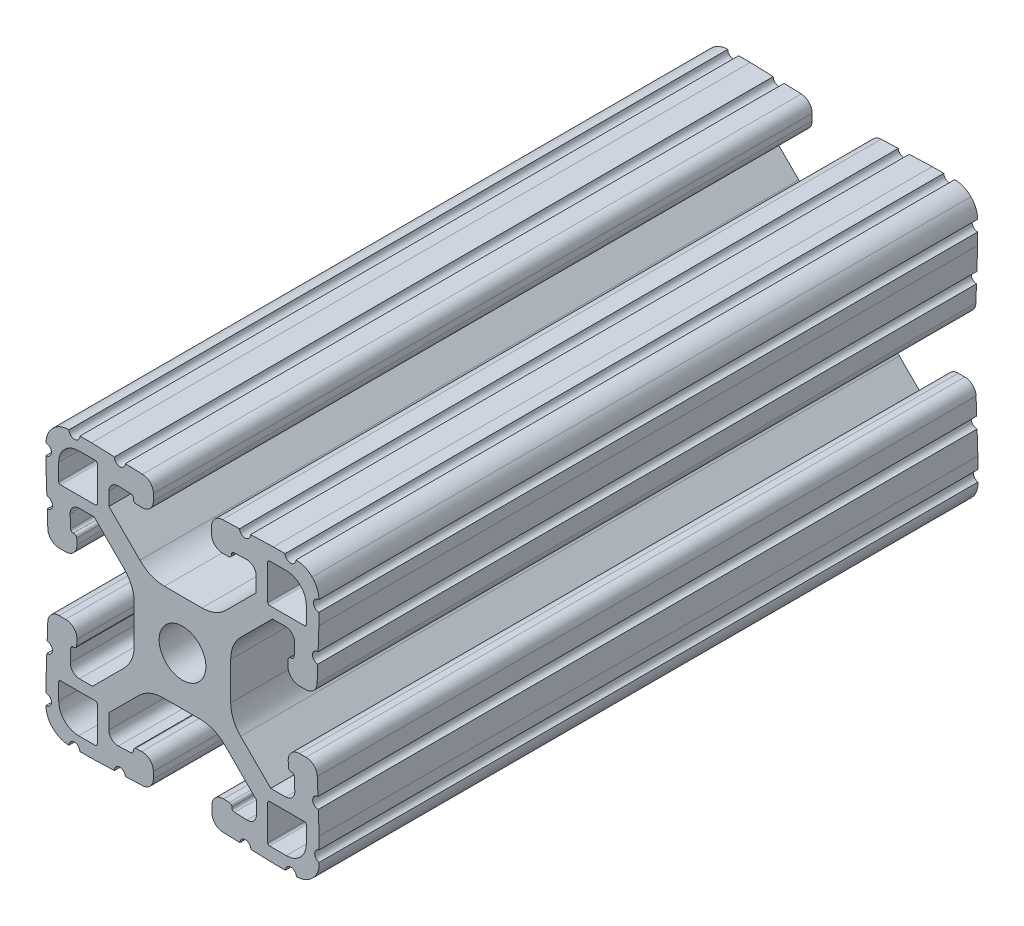
from build123d import *

# Parameters (mm, degrees)
SKETCH1_R           = 3.2639
BOSS_EXTRUDE1_DEPTH = 91.9353


with BuildPart() as part:
    # Sketch1 → Boss-Extrude1 (new body)
    with BuildSketch(Plane(origin=(0, 0, -25.4), x_dir=(-1, 0, 0), z_dir=(0, 0, -1))):
        with BuildLine():
            Line((-88.043721549, 91.862643967), (-86.29674679, 91.923648859))
            ThreePointArc((-86.29674679, 91.923648859), (-85.370208675, 91.567983831), (-84.982425017, 90.654422489))
            Line((-84.982425017, 90.654422489), (-84.982425017, 88.800173916))
            Line((-84.982425017, 88.800173916), (-89.306565884, 84.476033049))
            ThreePointArc((-89.306565884, 84.476033049), (-90.866149908, 83.406077005), (-92.719610366, 83.029523439))
            Line((-92.719610366, 83.029523439), (-97.961628589, 83.029523439))
            ThreePointArc((-97.961628589, 83.029523439), (-99.779298356, 83.391080435), (-101.320244378, 84.42070765))
            Line((-101.320244378, 84.42070765), (-105.516001761, 88.616465033))
            Line((-105.516001761, 88.616465033), (-105.516001761, 90.731330035))
            ThreePointArc((-105.516001761, 90.731330035), (-105.128218103, 91.644891377), (-104.201679988, 92.000556406))
            Line((-104.201679988, 92.000556406), (-102.454705229, 91.939551513))
            ThreePointArc((-102.454705229, 91.939551513), (-102.193933359, 91.823448504), (-102.087001761, 91.558783602))
            ThreePointArc((-102.087001761, 91.558783602), (-102.010859042, 91.249291513), (-101.726191901, 91.105946874))
            Line((-101.726191901, 91.105946874), (-100.929727576, 91.078102142))
            ThreePointArc((-100.929727576, 91.078102142), (-99.780779944, 91.519102656), (-99.299905511, 92.651940638))
            Line((-99.299905511, 92.651940638), (-99.299905511, 93.566848638))
            ThreePointArc((-99.299905511, 93.566848638), (-99.741889517, 94.660796975), (-100.819746715, 95.140689345))
            Line((-100.819746715, 95.140689345), (-103.211918901, 95.224224422))
            ThreePointArc((-103.211918901, 95.224224422), (-104.000045777, 94.489281495), (-104.734990687, 95.277406522))
            Line((-104.734990687, 95.277406522), (-107.935905676, 95.389166912))
            Line((-107.935905676, 95.389166912), (-109.561454876, 95.389166912))
            ThreePointArc((-109.561454876, 95.389166912), (-110.323454876, 94.627166912), (-111.085454876, 95.389166912))
            ThreePointArc((-111.085454876, 95.389166912), (-112.308767787, 95.144035599), (-113.343184761, 94.446493225))
            ThreePointArc((-113.343184761, 94.446493225), (-114.04072548, 93.412075135), (-114.285854836, 92.188761832))
            ThreePointArc((-114.285854836, 92.188761832), (-113.523853616, 91.426762441), (-114.285853616, 90.664761832))
            Line((-114.285853616, 90.664761832), (-114.285853616, 89.039212632))
            Line((-114.285853616, 89.039212632), (-114.174093219, 85.838297643))
            ThreePointArc((-114.174093219, 85.838297643), (-113.385968191, 85.103352735), (-114.120911115, 84.315225857))
            Line((-114.120911115, 84.315225857), (-114.037376031, 81.923053667))
            ThreePointArc((-114.037376031, 81.923053667), (-113.55748366, 80.845196472), (-112.463535325, 80.403212468))
            Line((-112.463535325, 80.403212468), (-111.548627325, 80.403212468))
            ThreePointArc((-111.548627325, 80.403212468), (-110.415788905, 80.884087354), (-109.974788872, 82.033035791))
            Line((-109.974788872, 82.033035791), (-110.002634241, 82.829500094))
            ThreePointArc((-110.002634241, 82.829500094), (-110.118742417, 83.090261917), (-110.383401914, 83.197188))
            ThreePointArc((-110.383401914, 83.197188), (-110.693757401, 83.272605688), (-110.837665276, 83.557735272))
            Line((-110.837665276, 83.557735272), (-110.898671566, 85.304709982))
            ThreePointArc((-110.898671566, 85.304709982), (-110.543006925, 86.231248747), (-109.62944523, 86.61903277))
            Line((-109.62944523, 86.61903277), (-107.807161806, 86.61903277))
            Line((-107.807161806, 86.61903277), (-103.364925613, 82.176810793))
            ThreePointArc((-103.364925613, 82.176810793), (-102.335294479, 80.635862907), (-101.973736029, 78.81818963))
            Line((-101.973736029, 78.81818963), (-101.973736029, 73.576034207))
            ThreePointArc((-101.973736029, 73.576034207), (-102.335293752, 71.758362684), (-103.364922926, 70.21741573))
            Line((-103.364922926, 70.21741573), (-107.560683666, 66.021661704))
            Line((-107.560683666, 66.021661704), (-109.652436558, 66.021661704))
            ThreePointArc((-109.652436558, 66.021661704), (-110.565998503, 66.409445617), (-110.921663765, 67.335984343))
            Line((-110.921663765, 67.335984343), (-110.860658873, 69.082959102))
            ThreePointArc((-110.860658873, 69.082959102), (-110.744555864, 69.343730973), (-110.479890961, 69.45066257))
            ThreePointArc((-110.479890961, 69.45066257), (-110.173494703, 69.529390272), (-110.032185196, 69.812424443))
            Line((-110.032185196, 69.812424443), (-110.004340464, 70.608888768))
            ThreePointArc((-110.004340464, 70.608888768), (-110.445340978, 71.7578364), (-111.57817896, 72.238710833))
            Line((-111.57817896, 72.238710833), (-112.49308696, 72.238710833))
            ThreePointArc((-112.49308696, 72.238710833), (-113.587035297, 71.796726827), (-114.066927667, 70.718869629))
            Line((-114.066927667, 70.718869629), (-114.150462744, 68.326697443))
            ThreePointArc((-114.150462744, 68.326697443), (-113.415519817, 67.538570567), (-114.203644843, 66.803625657))
            Line((-114.203644843, 66.803625657), (-114.315405233, 63.602710668))
            Line((-114.315405233, 63.602710668), (-114.315405233, 61.962557497))
            ThreePointArc((-114.315405233, 61.962557497), (-113.701927281, 61.206106537), (-114.333208228, 60.464447842))
            ThreePointArc((-114.333208228, 60.464447842), (-114.113020459, 59.176546471), (-113.392816136, 58.086372941))
            ThreePointArc((-113.392816136, 58.086372941), (-112.358398046, 57.388832223), (-111.135084743, 57.143702867))
            ThreePointArc((-111.135084743, 57.143702867), (-110.373085352, 57.905704086), (-109.611084743, 57.143704086))
            Line((-109.611084743, 57.143704086), (-107.985535543, 57.143704086))
            Line((-107.985535543, 57.143704086), (-104.784620554, 57.255464483))
            ThreePointArc((-104.784620554, 57.255464483), (-104.049675645, 58.04358951), (-103.261548768, 57.308646586))
            Line((-103.261548768, 57.308646586), (-100.869376578, 57.39218167))
            ThreePointArc((-100.869376578, 57.39218167), (-99.791519383, 57.872074041), (-99.349535378, 58.966022376))
            Line((-99.349535378, 58.966022376), (-99.349535378, 59.880930376))
            ThreePointArc((-99.349535378, 59.880930376), (-99.830409811, 61.013768358), (-100.979357443, 61.454768873))
            Line((-100.979357443, 61.454768873), (-101.775821768, 61.42692414))
            ThreePointArc((-101.775821768, 61.42692414), (-102.036583684, 61.310816174), (-102.143509978, 61.046156762))
            ThreePointArc((-102.143509978, 61.046156762), (-102.222494916, 60.740061862), (-102.505377386, 60.598958297))
            Line((-102.505377386, 60.598958297), (-104.252352145, 60.537953405))
            ThreePointArc((-104.252352145, 60.537953405), (-105.17889026, 60.893618433), (-105.566673918, 61.807179775))
            Line((-105.566673918, 61.807179775), (-105.566673918, 63.629462758))
            Line((-105.566673918, 63.629462758), (-101.131142468, 68.064994208))
            ThreePointArc((-101.131142468, 68.064994208), (-99.590196446, 69.094621422), (-97.772526678, 69.456178419))
            Line((-97.772526678, 69.456178419), (-92.530356056, 69.456178419))
            ThreePointArc((-92.530356056, 69.456178419), (-90.712686289, 69.094621422), (-89.171740267, 68.064994208))
            Line((-89.171740267, 68.064994208), (-84.975982884, 63.869236825))
            Line((-84.975982884, 63.869236825), (-84.975982884, 61.781050107))
            ThreePointArc((-84.975982884, 61.781050107), (-85.363766542, 60.867488765), (-86.290304657, 60.511823736))
            Line((-86.290304657, 60.511823736), (-88.037279416, 60.572828629))
            ThreePointArc((-88.037279416, 60.572828629), (-88.298051286, 60.688931638), (-88.404982884, 60.95359654))
            ThreePointArc((-88.404982884, 60.95359654), (-88.466593694, 61.278962759), (-88.759626911, 61.433204782))
            Line((-88.759626911, 61.433204782), (-89.556091237, 61.461049514))
            ThreePointArc((-89.556091237, 61.461049514), (-90.705038868, 61.020049), (-91.185913301, 59.887211018))
            Line((-91.185913301, 59.887211018), (-91.185913301, 58.972303018))
            ThreePointArc((-91.185913301, 58.972303018), (-90.743929295, 57.878354681), (-89.666072098, 57.398462311))
            Line((-89.666072098, 57.398462311), (-87.273899911, 57.314927234))
            ThreePointArc((-87.273899911, 57.314927234), (-86.485773036, 58.049870161), (-85.750828126, 57.261745135))
            Line((-85.750828126, 57.261745135), (-82.549913136, 57.149984745))
            Line((-82.549913136, 57.149984745), (-80.924363936, 57.149984745))
            ThreePointArc((-80.924363936, 57.149984745), (-80.162363936, 57.911984745), (-79.400363936, 57.149984745))
            ThreePointArc((-79.400363936, 57.149984745), (-78.177051025, 57.395116058), (-77.142634052, 58.092658432))
            ThreePointArc((-77.142634052, 58.092658432), (-76.445094372, 59.127074031), (-76.199963977, 60.350384428))
            ThreePointArc((-76.199963977, 60.350384428), (-76.961961268, 61.112385783), (-76.199961268, 61.874384428))
            Line((-76.199961268, 61.874384428), (-76.199961268, 63.499933628))
            Line((-76.199961268, 63.499933628), (-76.311721666, 66.700848617))
            ThreePointArc((-76.311721666, 66.700848617), (-77.099846694, 67.435793525), (-76.364903769, 68.223920403))
            Line((-76.364903769, 68.223920403), (-76.448438853, 70.616092593))
            ThreePointArc((-76.448438853, 70.616092593), (-76.928331225, 71.693949788), (-78.02227956, 72.135933792))
            Line((-78.02227956, 72.135933792), (-78.93718756, 72.135933792))
            ThreePointArc((-78.93718756, 72.135933792), (-80.07002598, 71.655058906), (-80.511026012, 70.506110469))
            Line((-80.511026012, 70.506110469), (-80.483180643, 69.709646166))
            ThreePointArc((-80.483180643, 69.709646166), (-80.367072468, 69.448884343), (-80.102412971, 69.34195826))
            ThreePointArc((-80.102412971, 69.34195826), (-79.796317908, 69.262973649), (-79.655214052, 68.980091239))
            Line((-79.655214052, 68.980091239), (-79.594207761, 67.233116529))
            ThreePointArc((-79.594207761, 67.233116529), (-79.949872402, 66.306577764), (-80.863434097, 65.918793741))
            Line((-80.863434097, 65.918793741), (-82.685717521, 65.918793741))
            Line((-82.685717521, 65.918793741), (-87.121258001, 70.35431293))
            ThreePointArc((-87.121258001, 70.35431293), (-88.150863946, 71.895196205), (-88.512450271, 73.712794894))
            Line((-88.512450271, 73.712794894), (-88.512606864, 78.954950317))
            ThreePointArc((-88.512606864, 78.954950317), (-88.151076291, 80.772698182), (-87.121419968, 82.313710679))
            Line((-87.121419968, 82.313710679), (-82.925659228, 86.509464706))
            Line((-82.925659228, 86.509464706), (-80.837473527, 86.509464706))
            ThreePointArc((-80.837473527, 86.509464706), (-79.923911584, 86.121680793), (-79.568246321, 85.195142068))
            Line((-79.568246321, 85.195142068), (-79.629251214, 83.448167309))
            ThreePointArc((-79.629251214, 83.448167309), (-79.745354223, 83.187395438), (-80.010019125, 83.080463841))
            ThreePointArc((-80.010019125, 83.080463841), (-80.335385344, 83.018853031), (-80.489627367, 82.725819813))
            Line((-80.489627367, 82.725819813), (-80.5174721, 81.929355488))
            ThreePointArc((-80.5174721, 81.929355488), (-80.076471586, 80.780407856), (-78.943633603, 80.299533423))
            Line((-78.943633603, 80.299533423), (-78.028725603, 80.299533423))
            ThreePointArc((-78.028725603, 80.299533423), (-76.934777267, 80.741517429), (-76.454884897, 81.819374627))
            Line((-76.454884897, 81.819374627), (-76.37134982, 84.211546813))
            ThreePointArc((-76.37134982, 84.211546813), (-77.106292747, 84.999673689), (-76.31816772, 85.734618599))
            Line((-76.31816772, 85.734618599), (-76.20640733, 88.935533588))
            Line((-76.20640733, 88.935533588), (-76.20640733, 90.561082788))
            ThreePointArc((-76.20640733, 90.561082788), (-76.96840733, 91.323083398), (-76.206406111, 92.085082788))
            ThreePointArc((-76.206406111, 92.085082788), (-76.451535467, 93.308396091), (-77.149076185, 94.342814181))
            ThreePointArc((-77.149076185, 94.342814181), (-78.183493159, 95.040356555), (-79.40680607, 95.285487868))
            ThreePointArc((-79.40680607, 95.285487868), (-80.16880607, 94.523487868), (-80.93080607, 95.285487868))
            Line((-80.93080607, 95.285487868), (-82.55635527, 95.285487868))
            Line((-82.55635527, 95.285487868), (-85.757270259, 95.173727471))
            ThreePointArc((-85.757270259, 95.173727471), (-86.492215168, 94.385602444), (-87.280342045, 95.120545368))
            Line((-87.280342045, 95.120545368), (-89.672514235, 95.037010285))
            ThreePointArc((-89.672514235, 95.037010285), (-90.75037143, 94.557117913), (-91.192355435, 93.463169578))
            Line((-91.192355435, 93.463169578), (-91.192355435, 92.548261578))
            ThreePointArc((-91.192355435, 92.548261578), (-90.711481002, 91.415423596), (-89.56253337, 90.974423082))
            Line((-89.56253337, 90.974423082), (-88.766069045, 91.002267814))
            ThreePointArc((-88.766069045, 91.002267814), (-88.505307129, 91.11837578), (-88.398380835, 91.383035192))
            ThreePointArc((-88.398380835, 91.383035192), (-88.336765486, 91.708407548), (-88.043721549, 91.862643967))
        make_face()
        with Locations((-95.25, 76.2)):
            Circle(SKETCH1_R, mode=Mode.SUBTRACT)
        with BuildLine():
            Line((-83.357745393, 88.294108398), (-83.357745393, 93.170908398))
            ThreePointArc((-83.357745393, 93.170908398), (-83.283351492, 93.350512545), (-83.103748154, 93.424908398))
            Line((-83.103748154, 93.424908398), (-80.766975763, 93.424933798))
            ThreePointArc((-80.766975763, 93.424933798), (-78.791299784, 92.606600882), (-77.972945393, 90.630933798))
            Line((-77.972945393, 90.630933798), (-77.972945393, 88.294108398))
            ThreePointArc((-77.972945393, 88.294108398), (-78.047340271, 88.114503276), (-78.226945393, 88.040108398))
            Line((-78.226945393, 88.040108398), (-83.103745393, 88.040108398))
            ThreePointArc((-83.103745393, 88.040108398), (-83.283350516, 88.114503276), (-83.357745393, 88.294108398))
        make_face(mode=Mode.SUBTRACT)
        with BuildLine():
            Line((-83.357745393, 59.229091602), (-83.357745393, 64.105891602))
            ThreePointArc((-83.357745393, 64.105891602), (-83.283350516, 64.285496724), (-83.103745393, 64.359891602))
            Line((-83.103745393, 64.359891602), (-78.226945393, 64.359891602))
            ThreePointArc((-78.226945393, 64.359891602), (-78.047340271, 64.285496724), (-77.972945393, 64.105891602))
            Line((-77.972945393, 64.105891602), (-77.972945393, 61.769066202))
            ThreePointArc((-77.972945393, 61.769066202), (-78.791299784, 59.793399118), (-80.766975763, 58.975066202))
            Line((-80.766975763, 58.975066202), (-83.103748154, 58.975091602))
            ThreePointArc((-83.103748154, 58.975091602), (-83.283351492, 59.049487455), (-83.357745393, 59.229091602))
        make_face(mode=Mode.SUBTRACT)
        with BuildLine():
            Line((-107.142254607, 93.170908398), (-107.142254607, 88.294108398))
            ThreePointArc((-107.142254607, 88.294108398), (-107.216649484, 88.114503276), (-107.396254607, 88.040108398))
            Line((-107.396254607, 88.040108398), (-112.273054607, 88.040108398))
            ThreePointArc((-112.273054607, 88.040108398), (-112.452659729, 88.114503276), (-112.527054607, 88.294108398))
            Line((-112.527054607, 88.294108398), (-112.527054607, 90.630933798))
            ThreePointArc((-112.527054607, 90.630933798), (-111.708700216, 92.606600882), (-109.733024237, 93.424933798))
            Line((-109.733024237, 93.424933798), (-107.396251846, 93.424908398))
            ThreePointArc((-107.396251846, 93.424908398), (-107.216648508, 93.350512545), (-107.142254607, 93.170908398))
        make_face(mode=Mode.SUBTRACT)
        with BuildLine():
            Line((-107.142254607, 64.105891602), (-107.142254607, 59.229091602))
            ThreePointArc((-107.142254607, 59.229091602), (-107.216648508, 59.049487455), (-107.396251846, 58.975091602))
            Line((-107.396251846, 58.975091602), (-109.733024237, 58.975066202))
            ThreePointArc((-109.733024237, 58.975066202), (-111.708700216, 59.793399118), (-112.527054607, 61.769066202))
            Line((-112.527054607, 61.769066202), (-112.527054607, 64.105891602))
            ThreePointArc((-112.527054607, 64.105891602), (-112.452659729, 64.285496724), (-112.273054607, 64.359891602))
            Line((-112.273054607, 64.359891602), (-107.396254607, 64.359891602))
            ThreePointArc((-107.396254607, 64.359891602), (-107.216649484, 64.285496724), (-107.142254607, 64.105891602))
        make_face(mode=Mode.SUBTRACT)
    extrude(amount=-BOSS_EXTRUDE1_DEPTH)


solid = part.part
